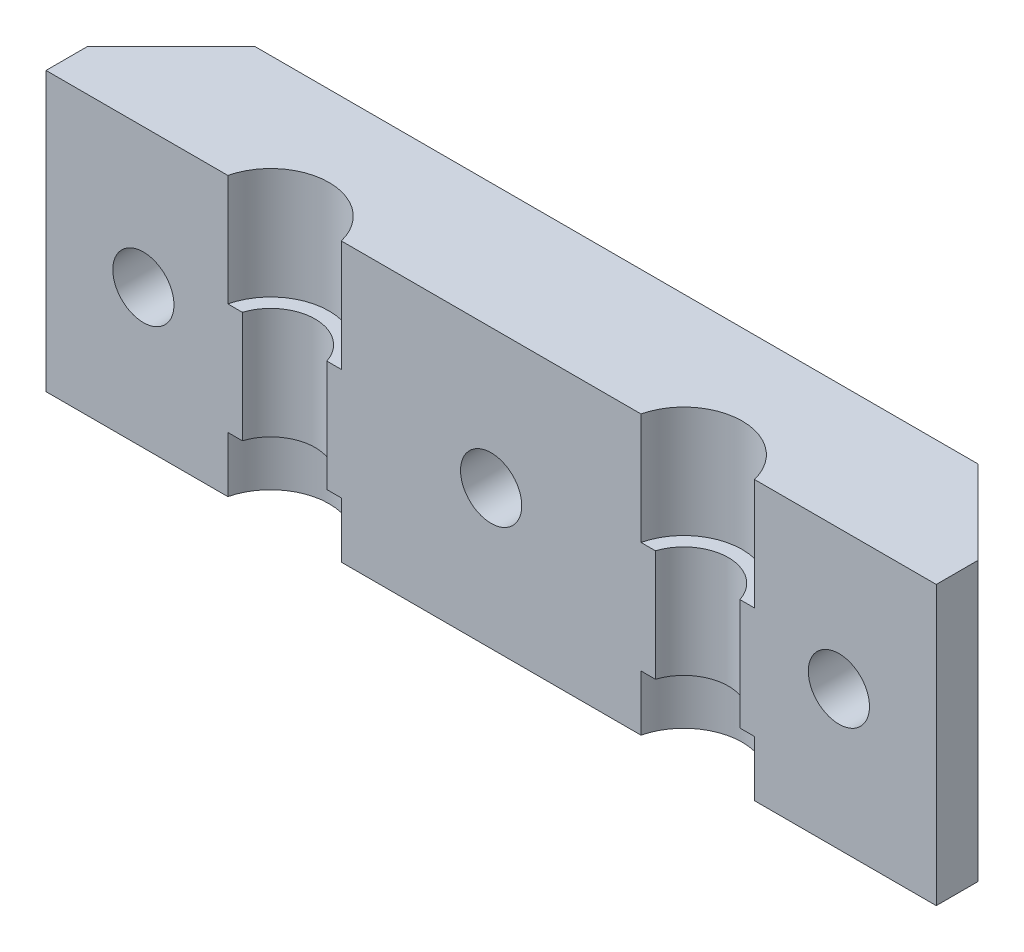
from build123d import *

# Parameters (mm, degrees)
SKETCH_1_W          = 32
SKETCH_1_H          = 10
EXTRUDE_1_DEPTH     = 4.5
SKETCH_2_R          = 2.1
CUT_EXTRUDE_1_DEPTH = 34.826764551
EXTRUDE_2_DEPTH     = 4
CHAMFER_1_SIZE      = 3
SKETCH_5_R          = 1.1
CUT_EXTRUDE_2_DEPTH = 34.826764551


with BuildPart() as part:
    # Эскиз1 → Бобышка-Вытянуть1 (new body)
    with BuildSketch(Plane.XY):
        with Locations((16, 5)):
            Rectangle(SKETCH_1_W, SKETCH_1_H)
    extrude(amount=EXTRUDE_1_DEPTH)

    # Эскиз2 → Вырез-Вытянуть1 (cut, through all)
    with BuildSketch(Plane(origin=(0, 10, 0), x_dir=(1, 0, 0), z_dir=(0, 1, 0))):
        with Locations((8.575, -5)):
            Circle(SKETCH_2_R)
        with Locations((23.425, -5)):
            Circle(SKETCH_2_R)
    extrude(amount=-CUT_EXTRUDE_1_DEPTH, mode=Mode.SUBTRACT)

    # Эскиз4 → Бобышка-Вытянуть2 (add)
    with BuildSketch(Plane.XZ.offset(-6)):
        with BuildLine():
            Line((6.535392195, 4.5), (7.055131585, 4.5))
            ThreePointArc((7.055131585, 4.5), (8.575, 3.4), (10.094868415, 4.5))
            Line((10.094868415, 4.5), (10.614607805, 4.5))
            ThreePointArc((10.614607805, 4.5), (8.575, 2.9), (6.535392195, 4.5))
        make_face()
        with BuildLine():
            Line((21.385392195, 4.5), (21.905131585, 4.5))
            ThreePointArc((21.905131585, 4.5), (23.425, 3.4), (24.944868415, 4.5))
            Line((24.944868415, 4.5), (25.464607805, 4.5))
            ThreePointArc((25.464607805, 4.5), (23.425, 2.9), (21.385392195, 4.5))
        make_face()
    extrude(amount=EXTRUDE_2_DEPTH)

    # Фаска1
    chamfer_1_edges = [part.edges().sort_by_distance(p)[0] for p in [
        (0, 5, 0),
        (32, 5, 0),
    ]]
    chamfer(chamfer_1_edges, length=CHAMFER_1_SIZE)

    # Эскиз5 → Вырез-Вытянуть2 (cut, through all)
    with BuildSketch(Plane(origin=(0, 0, 0), x_dir=(-1, 0, 0), z_dir=(0, 0, -1))):
        with Locations((-28.5, 5)):
            Circle(SKETCH_5_R)
        with Locations((-16, 5)):
            Circle(SKETCH_5_R)
        with Locations((-3.5, 5)):
            Circle(SKETCH_5_R)
    extrude(amount=-CUT_EXTRUDE_2_DEPTH, mode=Mode.SUBTRACT)

    # Фаска2: read off the stored shape, not the designer's step
    # Фаска2: loft between two sections, ruled curve by curve
    chamfer_2_from = [
        Edge.make_three_point_arc((3.288461538, 6.079468146, 1.5), (4.579468146, 5.211538462, 1.5), (3.711538462, 3.920531854, 1.5)),
        Edge.make_three_point_arc((3.711538462, 3.920531854, 1.5), (2.420531854, 4.788461538, 1.5), (3.288461538, 6.079468146, 1.5)),
    ]
    chamfer_2_to = [
        Edge.make_three_point_arc((2.999999479, 7.551472823, -2.709e-06), (6.051472823, 5.500000521, -2.709e-06), (4.000000521, 2.448527177, -2.709e-06)),
        Edge.make_three_point_arc((4.000000521, 2.448527177, -2.709e-06), (0.948527177, 4.499999479, -2.709e-06), (2.999999479, 7.551472823, -2.709e-06)),
    ]
    chamfer_2 = Solid(Shell([*[Face.make_surface_from_curves(chamfer_2_from[k], chamfer_2_to[k]) for k in range(2)], Face(Wire(chamfer_2_from)), Face(Wire(chamfer_2_to))]))
    add(chamfer_2, mode=Mode.SUBTRACT)

    # Chamfer 2 2: loft between two sections, ruled curve by curve
    chamfer_2_2_from = [
        Edge.make_three_point_arc((17.1, 5, 1.5), (16, 3.9, 1.5), (14.9, 5, 1.5)),
        Edge.make_three_point_arc((14.9, 5, 1.5), (16, 6.1, 1.5), (17.1, 5, 1.5)),
    ]
    chamfer_2_2_to = [
        Edge.make_three_point_arc((18.6, 5, 0), (16, 2.4, 0), (13.4, 5, 0)),
        Edge.make_three_point_arc((13.4, 5, 0), (16, 7.6, 0), (18.6, 5, 0)),
    ]
    chamfer_2_2 = Solid(Shell([*[Face.make_surface_from_curves(chamfer_2_2_from[k], chamfer_2_2_to[k]) for k in range(2)], Face(Wire(chamfer_2_2_from)), Face(Wire(chamfer_2_2_to))]))
    add(chamfer_2_2, mode=Mode.SUBTRACT)

    # Chamfer 2 3: loft between two sections, ruled curve by curve
    chamfer_2_3_from = [
        Edge.make_three_point_arc((28.711538462, 3.920531854, 1.5), (27.420531854, 4.788461538, 1.5), (28.288461538, 6.079468146, 1.5)),
        Edge.make_three_point_arc((28.288461538, 6.079468146, 1.5), (29.579468146, 5.211538462, 1.5), (28.711538462, 3.920531854, 1.5)),
    ]
    chamfer_2_3_to = [
        Edge.make_three_point_arc((29.000000521, 2.448527177, -2.709e-06), (25.948527177, 4.499999479, -2.709e-06), (27.999999479, 7.551472823, -2.709e-06)),
        Edge.make_three_point_arc((27.999999479, 7.551472823, -2.709e-06), (31.051472823, 5.500000521, -2.709e-06), (29.000000521, 2.448527177, -2.709e-06)),
    ]
    chamfer_2_3 = Solid(Shell([*[Face.make_surface_from_curves(chamfer_2_3_from[k], chamfer_2_3_to[k]) for k in range(2)], Face(Wire(chamfer_2_3_from)), Face(Wire(chamfer_2_3_to))]))
    add(chamfer_2_3, mode=Mode.SUBTRACT)


solid = part.part
